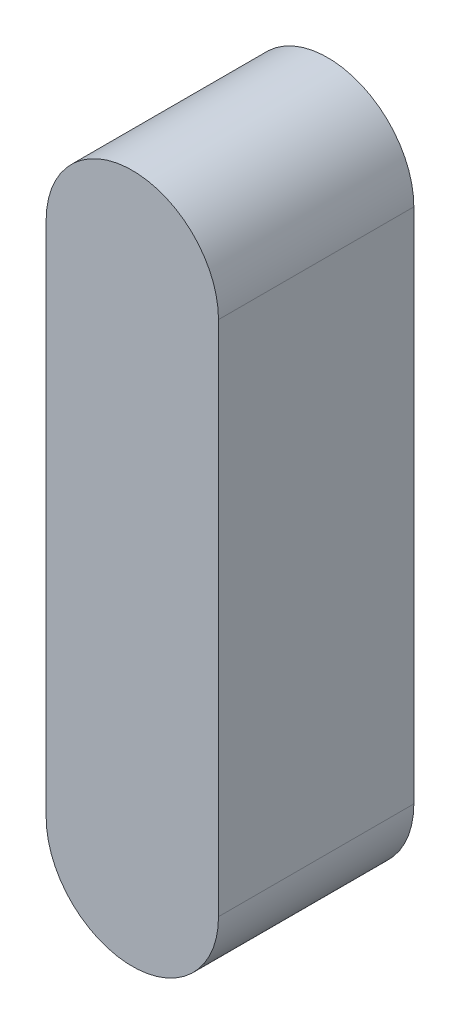
from build123d import *

# Parameters (mm, degrees)
LINK1_BODY_DEPTH = 8.5


with BuildPart() as part:
    # Link1_Outline → Link1_Body (new, symmetric)
    with BuildSketch(Plane.XY):
        with BuildLine():
            Line((-7.5, 0), (-7.5, 45))
            ThreePointArc((-7.5, 45), (0, 52.5), (7.5, 45))
            Line((7.5, 45), (7.5, 0))
            ThreePointArc((7.5, 0), (0, -7.5), (-7.5, 0))
        make_face()
    extrude(amount=LINK1_BODY_DEPTH, both=True)


solid = part.part
